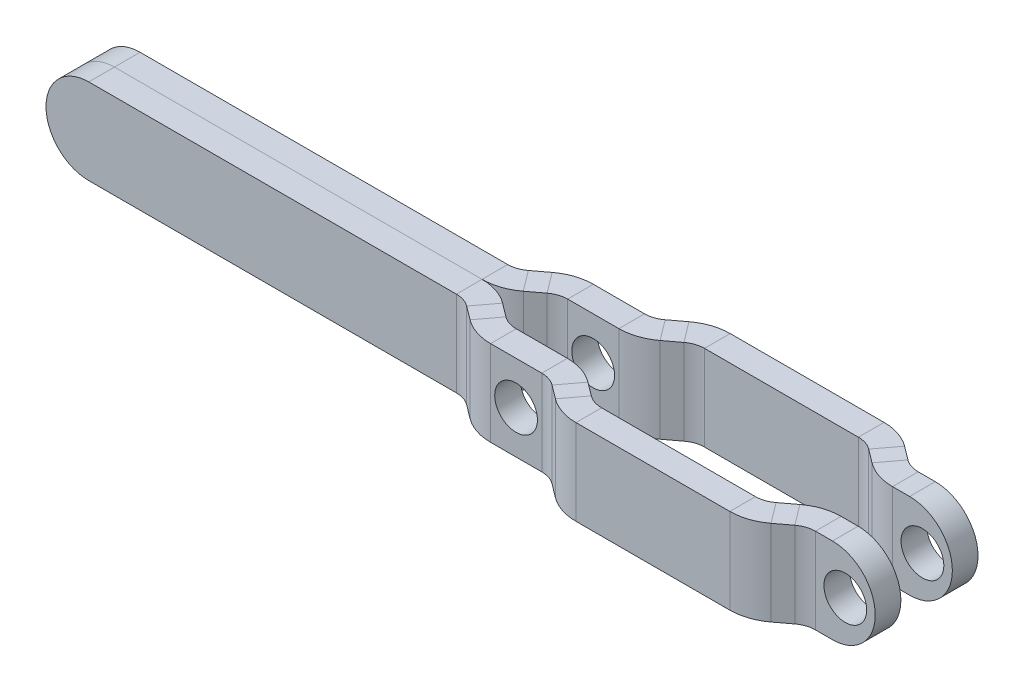
from build123d import *

# Parameters (mm, degrees)
BASE_FLANGE1_DEPTH = 5
SKETCH6_OUTSIDE_W  = 122.156
SKETCH6_OUTSIDE_H  = 32.176
CUT_EXTRUDE1_DEPTH = 101.509870076
SKETCH7_R          = 2.5
CUT_EXTRUDE2_DEPTH = 10


# Sheet-metal steps are written as plain solids
with BuildPart() as part:
    # Sketch1 → Base-Flange1 (new, symmetric)
    with BuildSketch(Plane(origin=(0, 0, 0), x_dir=(1, 0, 0), z_dir=(0, 1, 0))):
        with BuildLine():
            Line((0, 0), (47.992428083, 0))
            ThreePointArc((47.992428083, 0), (49.896256021, 0.310058069), (51.603318222, 1.20818694))
            Line((51.603318222, 1.20818694), (53.191518439, 2.404981646))
            ThreePointArc((53.191518439, 2.404981646), (54.04504954, 2.854046081), (54.996963509, 3.009075116))
            Line((54.996963509, 3.009075116), (60.985605633, 3.009075116))
            ThreePointArc((60.985605633, 3.009075116), (62.889433572, 3.319133185), (64.596495772, 4.217262055))
            Line((64.596495772, 4.217262055), (66.18469599, 5.414056762))
            ThreePointArc((66.18469599, 5.414056762), (67.03822709, 5.863121197), (67.990141059, 6.018150232))
            Line((67.990141059, 6.018150232), (85.982569142, 6.018150232))
            ThreePointArc((85.982569142, 6.018150232), (86.934483111, 5.863121197), (87.788014211, 5.414056762))
            Line((87.788014211, 5.414056762), (89.376214429, 4.217262055))
            ThreePointArc((89.376214429, 4.217262055), (91.083276629, 3.319133185), (92.987104568, 3.009075116))
            Line((92.987104568, 3.009075116), (99.979532651, 3.009075116))
            Line((99.979532651, 3.009075116), (99.979532651, 6.009075116))
            Line((99.979532651, 6.009075116), (92.987104568, 6.009075116))
            ThreePointArc((92.987104568, 6.009075116), (92.035190599, 6.16410415), (91.181659498, 6.613168586))
            Line((91.181659498, 6.613168586), (89.593459281, 7.809963292))
            ThreePointArc((89.593459281, 7.809963292), (87.88639708, 8.708092163), (85.982569142, 9.018150232))
            Line((85.982569142, 9.018150232), (67.990141059, 9.018150232))
            ThreePointArc((67.990141059, 9.018150232), (66.086313121, 8.708092163), (64.37925092, 7.809963292))
            Line((64.37925092, 7.809963292), (62.791050703, 6.613168586))
            ThreePointArc((62.791050703, 6.613168586), (61.937519602, 6.16410415), (60.985605633, 6.009075116))
            Line((60.985605633, 6.009075116), (54.996963509, 6.009075116))
            ThreePointArc((54.996963509, 6.009075116), (53.09313557, 5.699017047), (51.38607337, 4.800888176))
            Line((51.38607337, 4.800888176), (49.797873152, 3.60409347))
            ThreePointArc((49.797873152, 3.60409347), (48.944342052, 3.155029034), (47.992428083, 3))
            Line((47.992428083, 3), (0, 3))
            Line((0, 3), (0, 0))
        make_face()
    extrude(amount=BASE_FLANGE1_DEPTH, both=True)

    # Sketch6 outside → Cut-Extrude1 (cut, through all)
    with BuildSketch(Plane(origin=(0, 0, -9.018150232), x_dir=(-1, 0, 0), z_dir=(0, 0, -1))):
        with Locations((-49.99, 0)):
            Rectangle(SKETCH6_OUTSIDE_W, SKETCH6_OUTSIDE_H)
        with BuildLine():
            Line((-94.979532651, 5), (-5, 5))
            ThreePointArc((-5, 5), (0, 0), (-5, -5))
            Line((-5, -5), (-94.979532651, -5))
            ThreePointArc((-94.979532651, -5), (-99.979532651, 0), (-94.979532651, 5))
        make_face(mode=Mode.SUBTRACT)
    extrude(amount=-CUT_EXTRUDE1_DEPTH, mode=Mode.SUBTRACT)

    # Sketch7 → Cut-Extrude2 (cut)
    with BuildSketch(Plane(origin=(0, 0, -6.009075116), x_dir=(-1, 0, 0), z_dir=(0, 0, -1))):
        with Locations((-96.479532651, 0)):
            Circle(SKETCH7_R)
        with Locations((-57.979532651, 0)):
            Circle(SKETCH7_R)
    extrude(amount=-CUT_EXTRUDE2_DEPTH, mode=Mode.SUBTRACT)


with BuildPart() as body_2:
    # Mirror1: mirrored copy
    add(part.part.mirror(Plane.XY))


solid = Compound([part.part, body_2.part])
